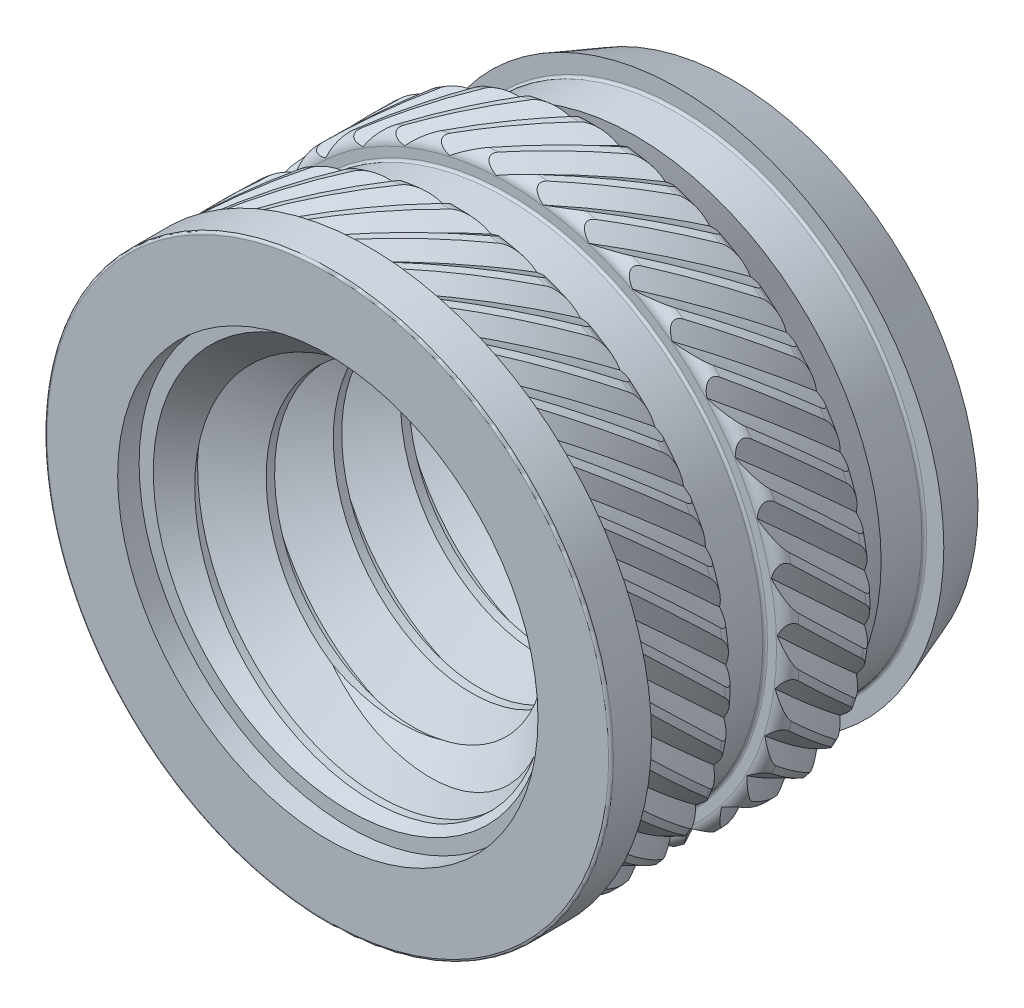
from build123d import *

# Parameters (mm, degrees)
SWEEP1_PITCH                 = 1.411111111
SKETCH7_R                    = 4.121507259
CUT_EXTRUDE1_OTHER_WAY_DEPTH = 13.450961833
CUT_EXTRUDE2_START           = -8.05815
SKETCH7_2_R                  = 4.121507259
CUT_EXTRUDE2_DEPTH           = 5.392811833
CUT_EXTRUDE2_OTHER_WAY_DEPTH = 13.450961833
CUT_EXTRUDE2_OTHER_WAY_TAPER = 45
CUT_SWEEP1_PITCH             = 38.242696629
CIRPATTERN1_COUNT            = 36


with BuildPart() as part:
    # Sketch3 → Revolve1 (revolve)
    with BuildSketch(Plane(origin=(0, 0, 0), x_dir=(0, 0, -1), z_dir=(1, 0, 0)), mode=Mode.PRIVATE) as revolve1_sk:
        with BuildLine():
            Line((1.376737079, 5.674487), (2.216472996, 5.163867925))
            Line((2.216472996, 5.163867925), (3.073299663, 5.163867925))
            ThreePointArc((3.073299663, 5.163867925), (3.109220687, 5.1787469), (3.124099663, 5.214667925))
            Line((3.124099663, 5.214667925), (3.124099663, 5.5753))
            Line((3.124099663, 5.5753), (4.2545, 5.163867925))
            Line((4.2545, 5.163867925), (4.2545, 3.96875))
            Line((4.2545, 3.96875), (-3.80365, 3.96875))
            Line((-3.80365, 3.96875), (-3.80365, 4.4196))
            Line((-3.80365, 4.4196), (-4.2545, 4.4196))
            Line((-4.2545, 4.4196), (-4.2545, 5.9055))
            ThreePointArc((-4.2545, 5.9055), (-4.239621024, 5.941421024), (-4.2037, 5.9563))
            Line((-4.2037, 5.9563), (-3.4036, 5.9563))
            Line((-3.4036, 5.9563), (-3.4036, 5.896737))
            Line((-3.4036, 5.896737), (-1.794776807, 5.896737))
            ThreePointArc((-1.794776807, 5.896737), (-1.624392771, 5.826161626), (-1.553817391, 5.655777591))
            Line((-1.553817391, 5.655777591), (-1.553817391, 5.465618182))
            ThreePointArc((-1.553817391, 5.465618182), (-1.538938416, 5.429697157), (-1.503017391, 5.414818182))
            Line((-1.503017391, 5.414818182), (-0.52384553, 5.414818182))
            ThreePointArc((-0.52384553, 5.414818182), (-0.487924506, 5.429697157), (-0.47304553, 5.465618182))
            Line((-0.47304553, 5.465618182), (-0.47304553, 5.655777591))
            ThreePointArc((-0.47304553, 5.655777591), (-0.402470153, 5.826161623), (-0.232086121, 5.896737))
            Line((-0.232086121, 5.896737), (1.154487079, 5.896737))
            ThreePointArc((1.154487079, 5.896737), (1.311641561, 5.831641482), (1.376737079, 5.674487))
        make_face()
    revolve(revolve1_sk.sketch.rotate(Axis((0, 0, 4.2545), (0, 0, -1)), 90), axis=Axis((0, 0, 4.2545), (0, 0, -1)))

    # Sweep1: the profile of Sketch6 screwed along a right-hand helix of 6.786 turns, 8 arcs to a turn; built about Z, then put on its axis
    sweep1_z = Axis((0, 0, 0), (0, 0, 1))
    sweep1_corners = [(3.052206448, 0, -0.705555556), (3.052206448, 0, -0.529166667), (4.045128629, 0, 0.044097222), (4.045128629, 0, -1.278819444)]
    with BuildLine(mode=Mode.PRIVATE) as sweep1_profile:
        Line(sweep1_corners[0], sweep1_corners[1])
        Line(sweep1_corners[1], sweep1_corners[2])
        Line(sweep1_corners[2], sweep1_corners[3])
        Line(sweep1_corners[3], sweep1_corners[0])
    sweep1_cap = Face(sweep1_profile.wire())
    sweep1_turn_angles = [0, 22.5, 45, 67.5, 90, 112.5, 135, 157.5, 180, 202.5, 225, 247.5, 270, 292.5, 315, 337.5, 360]
    sweep1_turn_weights = [1, 0.9238795325112867, 1, 0.9238795325112867, 1, 0.9238795325112867, 1, 0.9238795325112867, 1, 0.9238795325112867, 1, 0.9238795325112867, 1, 0.9238795325112867, 1, 0.9238795325112867, 1]
    sweep1_turn_rails = [Edge.make_bspline([Vector(p[0], p[1], 0).rotate(sweep1_z, sweep1_turn_angles[k]) / sweep1_turn_weights[k] + Vector(0, 0, p[2] + SWEEP1_PITCH * sweep1_turn_angles[k] / 360) for k in range(17)], [0, 0, 0, 1, 1, 2, 2, 3, 3, 4, 4, 5, 5, 6, 6, 7, 7, 8, 8, 8], 2, sweep1_turn_weights) for p in sweep1_corners]
    sweep1_turn_sides = [Face.make_surface_from_curves(sweep1_turn_rails[p[0]], sweep1_turn_rails[p[1]]) for p in [(0, 1), (1, 2), (2, 3), (3, 0)]]
    sweep1_last_angles = [2160, 2182.5, 2205, 2227.5, 2250, 2272.5, 2295, 2317.5, 2340, 2362.5, 2385, 2407.5, 2430, 2436.48, 2442.96]
    sweep1_last_weights = [1, 0.9238795325112867, 1, 0.9238795325112867, 1, 0.9238795325112867, 1, 0.9238795325112867, 1, 0.9238795325112867, 1, 0.9238795325112867, 1, 0.9936113105200196, 1]
    sweep1_last_rails = [Edge.make_bspline([Vector(p[0], p[1], 0).rotate(sweep1_z, sweep1_last_angles[k]) / sweep1_last_weights[k] + Vector(0, 0, p[2] + SWEEP1_PITCH * sweep1_last_angles[k] / 360) for k in range(15)], [0, 0, 0, 1, 1, 2, 2, 3, 3, 4, 4, 5, 5, 6, 6, 7, 7, 7], 2, sweep1_last_weights) for p in sweep1_corners]
    sweep1_last_sides = [Face.make_surface_from_curves(sweep1_last_rails[p[0]], sweep1_last_rails[p[1]]) for p in [(0, 1), (1, 2), (2, 3), (3, 0)]]
    sweep1 = Plane(origin=(0, 0, 4.2545), x_dir=(0, 1, 0), z_dir=(0, 0, -1)) * Solid(Shell([*[p.moved(Location((0, 0, SWEEP1_PITCH * i))) for i in range(6) for p in sweep1_turn_sides], *sweep1_last_sides, sweep1_cap, sweep1_cap.rotate(sweep1_z, 2442.96).moved(Location((0, 0, SWEEP1_PITCH * 2442.96 / 360)))]))
    add(sweep1)

    # Cut-Extrude1 cone 1 section (through the dimple's axis) → Cut-Extrude1 (revolve, cut)
    with BuildSketch(Plane(origin=(0, 0, 3.80365), x_dir=(0, -1, 0), z_dir=(1, 0, 0))):
        Polygon((0, 0), (4.121507259, 0), (0, 4.121507259), align=None)
    revolve(axis=Axis((0, 0, 3.80365), (0, 0, -1)), mode=Mode.SUBTRACT)

    # Sketch7 → Cut-Extrude1 other way (cut)
    with BuildSketch(Plane.XY.offset(3.80365)):
        Circle(SKETCH7_R)
    extrude(amount=CUT_EXTRUDE1_OTHER_WAY_DEPTH, mode=Mode.SUBTRACT)

    # Sketch7<2> → Cut-Extrude2 (cut)
    with BuildSketch(Plane.XY.offset(3.80365).offset(CUT_EXTRUDE2_START)):
        Circle(SKETCH7_2_R)
    extrude(amount=-CUT_EXTRUDE2_DEPTH, mode=Mode.SUBTRACT)

    # Sketch7<2> → Cut-Extrude2 other way (cut)
    with BuildSketch(Plane.XY.offset(3.80365).offset(CUT_EXTRUDE2_START)):
        Circle(SKETCH7_2_R)
    extrude(amount=CUT_EXTRUDE2_OTHER_WAY_DEPTH, taper=CUT_EXTRUDE2_OTHER_WAY_TAPER, mode=Mode.SUBTRACT)

    # Cut-Sweep1: the profile of Sketch8 screwed along a right-hand helix of 0.1375 turns, 24 arcs to a turn; built about Z, then put on its axis
    cut_sweep1_z = Axis((0, 0, 0), (0, 0, 1))
    cut_sweep1_corners = [(5.882372845, -0.41133558, 0), (5.674487, 0, 0), (5.882372845, 0.41133558, 0)]
    with BuildLine(mode=Mode.PRIVATE) as cut_sweep1_profile:
        Line(cut_sweep1_corners[0], cut_sweep1_corners[1])
        Line(cut_sweep1_corners[1], cut_sweep1_corners[2])
        ThreePointArc((5.882372845, 0.41133558, 0), (5.896737, 0, 0), (5.882372845, -0.41133558, 0))
    cut_sweep1_cap = Face(cut_sweep1_profile.wire())
    cut_sweep1_arcs = [((5.882372845, 0.41133558, 0), (5.911136231, 0, 0), (5.882372845, -0.41133558, 0), (1, 0.9975640502598244, 1))]  # start, shoulder, end, weights
    cut_sweep1_turn_angles = [0, 7.5, 15, 22.5, 30, 37.5, 45, 47.25, 49.5]
    cut_sweep1_turn_weights = [1, 0.9914448613738104, 1, 0.9914448613738104, 1, 0.9914448613738104, 1, 0.9992290362407229, 1]
    cut_sweep1_turn_rails = [Edge.make_bspline([Vector(p[0], p[1], 0).rotate(cut_sweep1_z, cut_sweep1_turn_angles[k]) / cut_sweep1_turn_weights[k] + Vector(0, 0, p[2] + CUT_SWEEP1_PITCH * cut_sweep1_turn_angles[k] / 360) for k in range(9)], [0, 0, 0, 1, 1, 2, 2, 3, 3, 4, 4, 4], 2, cut_sweep1_turn_weights) for p in cut_sweep1_corners]
    cut_sweep1_turn_sides = [*[Face.make_surface_from_curves(cut_sweep1_turn_rails[p[0]], cut_sweep1_turn_rails[p[1]]) for p in [(0, 1), (1, 2)]], *[Face.make_bezier_surface([[Vector(p[j][0], p[j][1], 0).rotate(cut_sweep1_z, cut_sweep1_turn_angles[2 * i + k]) / cut_sweep1_turn_weights[2 * i + k] + Vector(0, 0, p[j][2] + CUT_SWEEP1_PITCH * cut_sweep1_turn_angles[2 * i + k] / 360) for k in range(3)] for j in range(3)], [[p[3][j] * cut_sweep1_turn_weights[2 * i + k] for k in range(3)] for j in range(3)]) for p in cut_sweep1_arcs for i in range(4)]]
    cut_sweep1 = Plane(origin=(0, 0, 3.4036), x_dir=(0, 1, 0), z_dir=(0, 0, -1)) * Solid(Shell([*cut_sweep1_turn_sides, cut_sweep1_cap, cut_sweep1_cap.rotate(cut_sweep1_z, 49.5).moved(Location((0, 0, CUT_SWEEP1_PITCH * 49.5 / 360)))]))
    add(cut_sweep1, mode=Mode.SUBTRACT)

    # CirPattern1: Cut-Sweep1 ×36 about axis
    cirpattern1_axis = Axis((0, 0, 4.2545), (0, 0, -1))
    for i in range(1, CIRPATTERN1_COUNT):
        add(cut_sweep1.rotate(cirpattern1_axis, i * 360 / CIRPATTERN1_COUNT), mode=Mode.SUBTRACT)


solid = part.part
